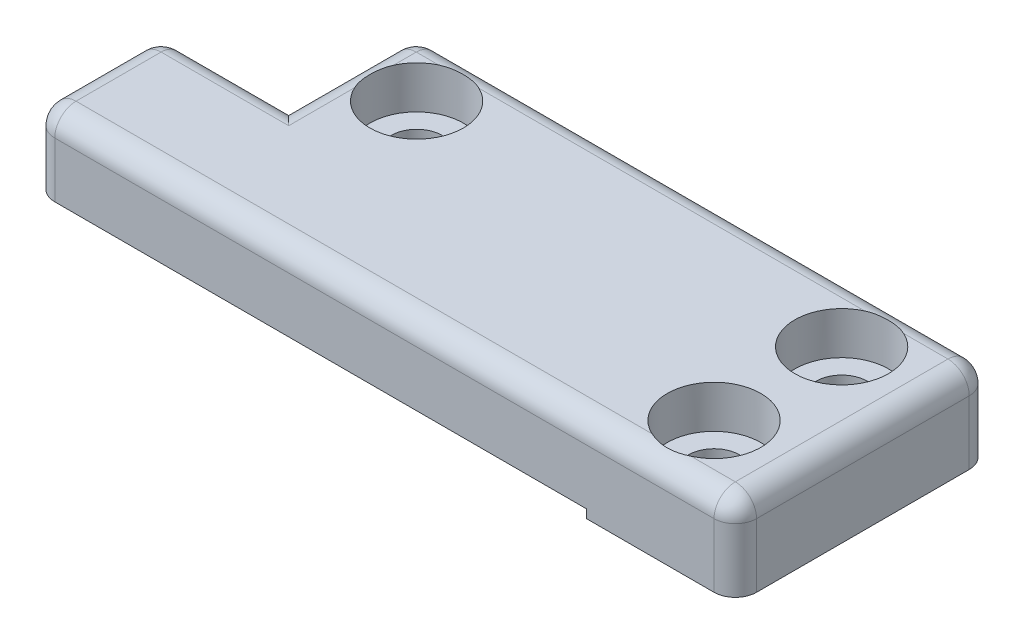
from build123d import *

# Parameters (mm, degrees)
EXTRUDE_1_DEPTH     = 4
CUT_EXTRUDE_START   = 4
SKETCH_2_R          = 2.2
CUT_EXTRUDE_2_DEPTH = 2
SKETCH_3_R          = 2.2
CUT_EXTRUDE_3_DEPTH = 2
SKETCH_4_R          = 1.2
CUT_EXTRUDE_4_DEPTH = 22.260291625
SKETCH_5_R          = 1.2
CUT_EXTRUDE_5_DEPTH = 22.260291625
FILLET_1_R          = 1
SKETCH_6_W          = 26
SKETCH_6_H          = 6
CUT_EXTRUDE_8_DEPTH = 0.4


with BuildPart() as part:
    # 草圖1 → 填料-伸長1 (new body)
    with BuildSketch(Plane(origin=(0, 0, 0), x_dir=(1, 0, 0), z_dir=(0, 1, 0))):
        Polygon((-13, -6), (20, -6), (20, 6), (-7, 6), (-7, 0), (-13, 0), align=None)
    extrude(amount=EXTRUDE_1_DEPTH)

    # 草圖2 → 除料-伸長2 (cut)
    with BuildSketch(Plane(origin=(0, 0, 0), x_dir=(1, 0, 0), z_dir=(0, 1, 0)).offset(CUT_EXTRUDE_START)):
        with Locations(Location((-4, 3.015018989, 0), (0, 0, 270))):
            Circle(SKETCH_2_R)
    extrude(amount=-CUT_EXTRUDE_2_DEPTH, mode=Mode.SUBTRACT)

    # 草圖3 → 除料-伸長3 (cut)
    with BuildSketch(Plane(origin=(0, 0, 0), x_dir=(1, 0, 0), z_dir=(0, 1, 0)).offset(CUT_EXTRUDE_START)):
        with Locations(Location((16, -3, 0), (0, 0, 270))):
            Circle(SKETCH_3_R)
        with Locations(Location((16, 3, 0), (0, 0, 90))):
            Circle(SKETCH_3_R)
    extrude(amount=-CUT_EXTRUDE_3_DEPTH, mode=Mode.SUBTRACT)

    # 草圖4 → 除料-伸長4 (cut, through all)
    with BuildSketch(Plane(origin=(0, 0, 0), x_dir=(1, 0, 0), z_dir=(0, 1, 0))):
        with Locations(Location((-4, 3.015018989, 0), (0, 0, 270))):
            Circle(SKETCH_4_R)
        with Locations(Location((16, -3, 0), (0, 0, 270))):
            Circle(SKETCH_4_R)
    extrude(amount=CUT_EXTRUDE_4_DEPTH, mode=Mode.SUBTRACT)

    # 草圖5 → 除料-伸長5 (cut, through all)
    with BuildSketch(Plane(origin=(0, 0, 0), x_dir=(1, 0, 0), z_dir=(0, 1, 0))):
        with Locations(Location((16, 3, 0), (0, 0, 90))):
            Circle(SKETCH_5_R)
    extrude(amount=CUT_EXTRUDE_5_DEPTH, mode=Mode.SUBTRACT)

    # 圓角1
    # the kernel refuses this fillet: 1 mm, written as the material it takes off along each edge
    with BuildSketch(Plane(origin=(19, 3, 5), x_dir=(1, 0, 0), z_dir=(0, 0, 1))) as fillet_1_piece_1_section:
        Polygon((0, 0), (FILLET_1_R, 0), (FILLET_1_R, FILLET_1_R), (0, FILLET_1_R), align=None)
    fillet_1_piece_1 = extrude(amount=FILLET_1_R, mode=Mode.PRIVATE)
    fillet_1_piece_1 = fillet_1_piece_1 - Plane(origin=(19, 3, 5), x_dir=(-0.7071067811865475, -0.7071067811865475, 0), z_dir=(0, 0, 1)) * Sphere(FILLET_1_R, mode=Mode.PRIVATE)
    add(fillet_1_piece_1, mode=Mode.SUBTRACT)
    with BuildSketch(Plane(origin=(19, 3, -5), x_dir=(0, 1, 0), z_dir=(1, 0, 0))) as fillet_1_piece_2_section:
        Polygon((0, 0), (FILLET_1_R, 0), (FILLET_1_R, -FILLET_1_R), (0, -FILLET_1_R), align=None)
    fillet_1_piece_2 = extrude(amount=FILLET_1_R, mode=Mode.PRIVATE)
    fillet_1_piece_2 = fillet_1_piece_2 - Plane(origin=(19, 3, -5), x_dir=(0, -0.7071067811865475, 0.7071067811865475), z_dir=(1, 0, 0)) * Sphere(FILLET_1_R, mode=Mode.PRIVATE)
    add(fillet_1_piece_2, mode=Mode.SUBTRACT)
    with BuildSketch(Plane(origin=(-12, 3, 1), x_dir=(0, 1, 0), z_dir=(-1, 0, 0))) as fillet_1_piece_3_section:
        Polygon((0, 0), (FILLET_1_R, 0), (FILLET_1_R, FILLET_1_R), (0, FILLET_1_R), align=None)
    fillet_1_piece_3 = extrude(amount=FILLET_1_R, mode=Mode.PRIVATE)
    fillet_1_piece_3 = fillet_1_piece_3 - Plane(origin=(-12, 3, 1), x_dir=(0, -0.7071067811865475, 0.7071067811865475), z_dir=(-1, 0, 0)) * Sphere(FILLET_1_R, mode=Mode.PRIVATE)
    add(fillet_1_piece_3, mode=Mode.SUBTRACT)
    with BuildSketch(Plane(origin=(-6, 3, -5), x_dir=(0, 0, -1), z_dir=(0, 1, 0))) as fillet_1_piece_4_section:
        Polygon((0, 0), (FILLET_1_R, 0), (FILLET_1_R, FILLET_1_R), (0, FILLET_1_R), align=None)
    fillet_1_piece_4 = extrude(amount=FILLET_1_R, mode=Mode.PRIVATE)
    fillet_1_piece_4 = fillet_1_piece_4 - Plane(origin=(-6, 3, -5), x_dir=(0.7071067811865475, 0, 0.7071067811865477), z_dir=(0, 1, 0)) * Sphere(FILLET_1_R, mode=Mode.PRIVATE)
    add(fillet_1_piece_4, mode=Mode.SUBTRACT)
    with BuildSketch(Plane(origin=(-12, 3, 5), x_dir=(-1, 0, 0), z_dir=(0, 0, 1))) as fillet_1_piece_5_section:
        Polygon((0, 0), (FILLET_1_R, 0), (FILLET_1_R, -FILLET_1_R), (0, -FILLET_1_R), align=None)
    fillet_1_piece_5 = extrude(amount=FILLET_1_R, mode=Mode.PRIVATE)
    fillet_1_piece_5 = fillet_1_piece_5 - Plane(origin=(-12, 3, 5), x_dir=(0.7071067811865475, -0.7071067811865475, 0), z_dir=(0, 0, 1)) * Sphere(FILLET_1_R, mode=Mode.PRIVATE)
    add(fillet_1_piece_5, mode=Mode.SUBTRACT)
    with BuildSketch(Plane(origin=(20, 4, 5), x_dir=(0, -1, 0), z_dir=(0, 0, -1))) as fillet_1_piece_6:
        with BuildLine():
            CenterArc((FILLET_1_R, FILLET_1_R), FILLET_1_R, 180, 90)
            Line((0, FILLET_1_R), (0, 0))
            Line((0, 0), (FILLET_1_R, 0))
        make_face()
    extrude(amount=10, mode=Mode.SUBTRACT)
    with BuildSketch(Plane(origin=(-13, -2.5, 0), x_dir=(0, 0, 1), z_dir=(0, 1, 0)), Plane(origin=(-13, -2.5, 6), x_dir=(1, 0, 0), z_dir=(0, 1, 0))) as fillet_1_piece_7:
        with BuildLine():
            CenterArc((FILLET_1_R, FILLET_1_R), FILLET_1_R, 180, 90)
            Line((0, FILLET_1_R), (0, 0))
            Line((0, 0), (FILLET_1_R, 0))
        make_face()
    extrude(amount=5.5, mode=Mode.SUBTRACT)
    with BuildSketch(Plane(origin=(-7, -2.5, -6), x_dir=(1, 0, 0), z_dir=(0, 1, 0)), Plane(origin=(20, -2.5, -6), x_dir=(0, 0, 1), z_dir=(0, 1, 0)), Plane(origin=(20, -2.5, 6), x_dir=(-1, 0, 0), z_dir=(0, 1, 0))) as fillet_1_piece_8:
        with BuildLine():
            CenterArc((FILLET_1_R, -FILLET_1_R), FILLET_1_R, 90, 90)
            Line((0, -FILLET_1_R), (0, 0))
            Line((0, 0), (FILLET_1_R, 0))
        make_face()
    extrude(amount=5.5, mode=Mode.SUBTRACT)
    with BuildSketch(Plane(origin=(19, 4, -6), x_dir=(0, 0, 1), z_dir=(-1, 0, 0))) as fillet_1_piece_9:
        with BuildLine():
            CenterArc((FILLET_1_R, -FILLET_1_R), FILLET_1_R, 90, 90)
            Line((0, -FILLET_1_R), (0, 0))
            Line((0, 0), (FILLET_1_R, 0))
        make_face()
    extrude(amount=25, mode=Mode.SUBTRACT)
    with BuildSketch(Plane(origin=(-7, 4, -5), x_dir=(1, 0, 0), z_dir=(0, 0, 1)), Plane(origin=(-7, 4, 0), x_dir=(0, 0, 1), z_dir=(-1, 0, 0))) as fillet_1_piece_10:
        with BuildLine():
            CenterArc((FILLET_1_R, -FILLET_1_R), FILLET_1_R, 90, 90)
            Line((0, -FILLET_1_R), (0, 0))
            Line((0, 0), (FILLET_1_R, 0))
        make_face()
    extrude(amount=5, mode=Mode.SUBTRACT)
    with BuildSketch(Plane(origin=(-13, 4, 1), x_dir=(0, -1, 0), z_dir=(0, 0, 1))) as fillet_1_piece_11:
        with BuildLine():
            CenterArc((FILLET_1_R, FILLET_1_R), FILLET_1_R, 180, 90)
            Line((0, FILLET_1_R), (0, 0))
            Line((0, 0), (FILLET_1_R, 0))
        make_face()
    extrude(amount=4, mode=Mode.SUBTRACT)
    with BuildSketch(Plane(origin=(-12, 4, 6), x_dir=(0, -1, 0), z_dir=(1, 0, 0))) as fillet_1_piece_12:
        with BuildLine():
            CenterArc((FILLET_1_R, FILLET_1_R), FILLET_1_R, 180, 90)
            Line((0, FILLET_1_R), (0, 0))
            Line((0, 0), (FILLET_1_R, 0))
        make_face()
    extrude(amount=31, mode=Mode.SUBTRACT)
    with BuildSketch(Plane(origin=(-4.5, 4, 0), x_dir=(0, 0, 1), z_dir=(-1, 0, 0))) as fillet_1_piece_13a_section:
        with BuildLine():
            CenterArc((FILLET_1_R, -FILLET_1_R), FILLET_1_R, 90, 90)
            Line((0, -FILLET_1_R), (0, 0))
            Line((0, 0), (FILLET_1_R, 0))
        make_face()
    fillet_1_piece_13a = extrude(amount=7.5, mode=Mode.PRIVATE)
    fillet_1_piece_13a = split(fillet_1_piece_13a, bisect_by=Plane(origin=(-7, 3.773604886, 0.226395114), z_dir=(1, 0, 0)), keep=Keep.TOP, mode=Mode.PRIVATE)
    with BuildSketch(Plane(origin=(-7, 4, -5), x_dir=(1, 0, 0), z_dir=(0, 0, 1))) as fillet_1_piece_13b_section:
        with BuildLine():
            CenterArc((FILLET_1_R, -FILLET_1_R), FILLET_1_R, 90, 90)
            Line((0, -FILLET_1_R), (0, 0))
            Line((0, 0), (FILLET_1_R, 0))
        make_face()
    fillet_1_piece_13b = extrude(amount=7.5, mode=Mode.PRIVATE)
    fillet_1_piece_13b = split(fillet_1_piece_13b, bisect_by=Plane(origin=(-6.773604886, 3.773604886, 0), z_dir=(0, 0, 1)), keep=Keep.TOP, mode=Mode.PRIVATE)
    fillet_1_piece_13 = fillet_1_piece_13a & fillet_1_piece_13b
    add(fillet_1_piece_13, mode=Mode.SUBTRACT)

    # 草圖6 → 除料-伸長8 (cut)
    with BuildSketch(Plane(origin=(0, 0, 0), x_dir=(1, 0, 0), z_dir=(0, 1, 0))):
        with Locations((0, -3)):
            Rectangle(SKETCH_6_W, SKETCH_6_H)
    extrude(amount=CUT_EXTRUDE_8_DEPTH, mode=Mode.SUBTRACT)


solid = part.part
